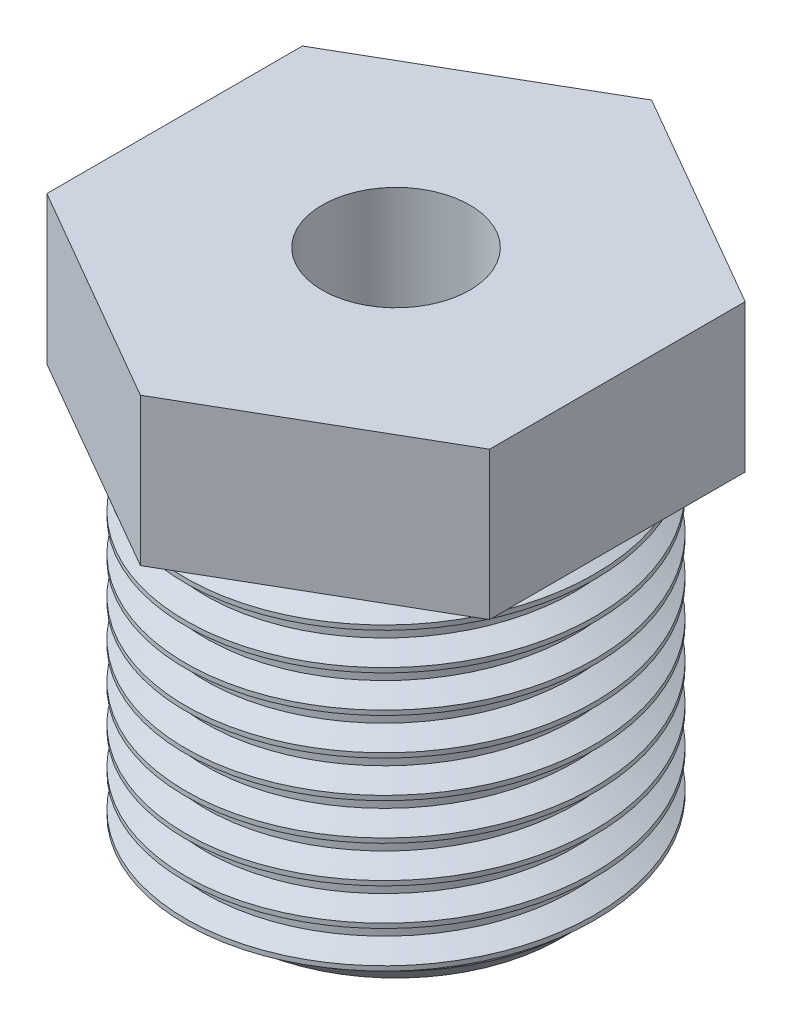
from build123d import *
from build123d.topology import SkipClean

# Parameters (mm, degrees)
SKETCH1_R               = 5
BOSS_EXTRUDE1_DEPTH     = 10
CHAMFER1_SIZE           = 0.55
SKETCH2_R               = 6
SKETCH2_R_2             = 5
BOSS_EXTRUDE3_DEPTH     = 4
CUT_EXTRUDE1_DEPTH      = 17.733200531
CUT_EXTRUDE1_DEPTH_BACK = 17.733200531
SKETCH5_R               = 2
THREAD1_PITCH           = 1


with BuildPart() as part:
    # Sketch1 → Boss-Extrude1 (new body)
    with BuildSketch(Plane(origin=(0, 0, 0), x_dir=(1, 0, 0), z_dir=(0, 1, 0))):
        with Locations(Location((0, 0, 0), (0, 0, 270))):
            Circle(SKETCH1_R)
    extrude(amount=BOSS_EXTRUDE1_DEPTH)

    # Chamfer1
    chamfer1_edges = [part.edges().sort_by_distance(p)[0] for p in [
        (0, 0, -5),
    ]]
    chamfer(chamfer1_edges, length=CHAMFER1_SIZE)

    # Sketch2 → Boss-Extrude3 (add)
    # profile 1 of 8: a face of its own
    with BuildSketch(Plane(origin=(0, 10, 0), x_dir=(1, 0, 0), z_dir=(0, 1, 0))):
        Circle(SKETCH2_R)
        with Locations(Location((0, 0, 0), (0, 0, 270))):
            Circle(SKETCH2_R_2, mode=Mode.SUBTRACT)
    # profile 2 of 8: a face of its own
    with BuildSketch(Plane(origin=(0, 10, 0), x_dir=(1, 0, 0), z_dir=(0, 1, 0))):
        with BuildLine():
            ThreePointArc((-6, -5e-09), (-5.196152438, 2.999999974), (-3.000000049, 5.196152395))
            Line((-3.000000049, 5.196152395), (-6, 3.464101615))
            Line((-6, 3.464101615), (-6, -5e-09))
        make_face()
    # profile 3 of 8: a face of its own
    with BuildSketch(Plane(origin=(0, 10, 0), x_dir=(1, 0, 0), z_dir=(0, 1, 0))):
        with Locations(Location((0, 0, 0), (0, 0, 270))):
            Circle(SKETCH2_R_2)
    # profile 4 of 8: a face of its own
    with BuildSketch(Plane(origin=(0, 10, 0), x_dir=(1, 0, 0), z_dir=(0, 1, 0))):
        with BuildLine():
            Line((3.000000049, 5.196152395), (0, 6.92820323))
            Line((0, 6.92820323), (-3.000000049, 5.196152395))
            ThreePointArc((-3.000000049, 5.196152395), (0, 6), (3.000000049, 5.196152395))
        make_face()
    # profile 5 of 8: a face of its own
    with BuildSketch(Plane(origin=(0, 10, 0), x_dir=(1, 0, 0), z_dir=(0, 1, 0))):
        with BuildLine():
            Line((6, 3.464101615), (3.000000049, 5.196152395))
            ThreePointArc((3.000000049, 5.196152395), (5.196152437, 2.999999976), (6, 0))
            Line((6, 0), (6, 3.464101615))
        make_face()
    # profile 6 of 8: a face of its own
    with BuildSketch(Plane(origin=(0, 10, 0), x_dir=(1, 0, 0), z_dir=(0, 1, 0))):
        with BuildLine():
            Line((6, -3.464101615), (6, 0))
            ThreePointArc((6, 0), (5.196152437, -2.999999976), (3.000000049, -5.196152395))
            Line((3.000000049, -5.196152395), (6, -3.464101615))
        make_face()
    # profile 7 of 8: a face of its own
    with BuildSketch(Plane(origin=(0, 10, 0), x_dir=(1, 0, 0), z_dir=(0, 1, 0))):
        with BuildLine():
            ThreePointArc((3.000000049, -5.196152395), (-1.7e-08, -6), (-3.000000078, -5.196152378))
            Line((-3.000000078, -5.196152378), (0, -6.92820323))
            Line((0, -6.92820323), (3.000000049, -5.196152395))
        make_face()
    # profile 8 of 8: a face of its own
    with BuildSketch(Plane(origin=(0, 10, 0), x_dir=(1, 0, 0), z_dir=(0, 1, 0))):
        with BuildLine():
            ThreePointArc((-3.000000078, -5.196152378), (-5.196152444, -2.999999963), (-6, -5e-09))
            Line((-6, -5e-09), (-6, -3.464101615))
            Line((-6, -3.464101615), (-3.000000078, -5.196152378))
        make_face()
    extrude(amount=BOSS_EXTRUDE3_DEPTH)

    # Sketch5 → Cut-Extrude1 (cut, two sides: drawn at the far end of the back side and taken through both)
    with BuildSketch(Plane(origin=(0, 14, 0), x_dir=(1, 0, 0), z_dir=(0, 1, 0)).offset(-CUT_EXTRUDE1_DEPTH_BACK)):
        with Locations(Location((0, 0, 0), (0, 0, 270))):
            Circle(SKETCH5_R)
    extrude(amount=CUT_EXTRUDE1_DEPTH + CUT_EXTRUDE1_DEPTH_BACK, mode=Mode.SUBTRACT)

    # Thread1: the profile of Thread Profile1 profile screwed along a right-hand helix of 9 turns, 8 arcs to a turn; built about Z, then put on its axis
    with SkipClean():  # the faces are left unmerged after this step: merging them gives an invalid solid
        thread1_z = Axis((0, 0, 0), (0, 0, 1))
        thread1_corners = [(4.9997, 0, -0.000173205), (5.541265875, 0, 0.312499999), (5.541265875, 0, 0.437499999), (4.9997, 0, 0.750173202)]
        with BuildLine(mode=Mode.PRIVATE) as thread1_profile:
            Line(thread1_corners[0], thread1_corners[1])
            Line(thread1_corners[1], thread1_corners[2])
            Line(thread1_corners[2], thread1_corners[3])
            Line(thread1_corners[3], thread1_corners[0])
        thread1_cap = Face(thread1_profile.wire())
        thread1_turn_angles = [0, 22.5, 45, 67.5, 90, 112.5, 135, 157.5, 180, 202.5, 225, 247.5, 270, 292.5, 315, 337.5, 360]
        thread1_turn_weights = [1, 0.9238795325112867, 1, 0.9238795325112867, 1, 0.9238795325112867, 1, 0.9238795325112867, 1, 0.9238795325112867, 1, 0.9238795325112867, 1, 0.9238795325112867, 1, 0.9238795325112867, 1]
        thread1_turn_rails = [Edge.make_bspline([Vector(p[0], p[1], 0).rotate(thread1_z, thread1_turn_angles[k]) / thread1_turn_weights[k] + Vector(0, 0, p[2] + THREAD1_PITCH * thread1_turn_angles[k] / 360) for k in range(17)], [0, 0, 0, 1, 1, 2, 2, 3, 3, 4, 4, 5, 5, 6, 6, 7, 7, 8, 8, 8], 2, thread1_turn_weights) for p in thread1_corners]
        thread1_turn_sides = [Face.make_surface_from_curves(thread1_turn_rails[p[0]], thread1_turn_rails[p[1]]) for p in [(0, 1), (1, 2), (2, 3), (3, 0)]]
        thread1 = Plane(origin=(0, 10, 0), x_dir=(-1, 0, 0), z_dir=(0, -1, 0)) * Solid(Shell([*[p.moved(Location((0, 0, THREAD1_PITCH * i))) for i in range(9) for p in thread1_turn_sides], thread1_cap, thread1_cap.rotate(thread1_z, 3240).moved(Location((0, 0, THREAD1_PITCH * 3240 / 360)))]))
        add(thread1)


solid = part.part
